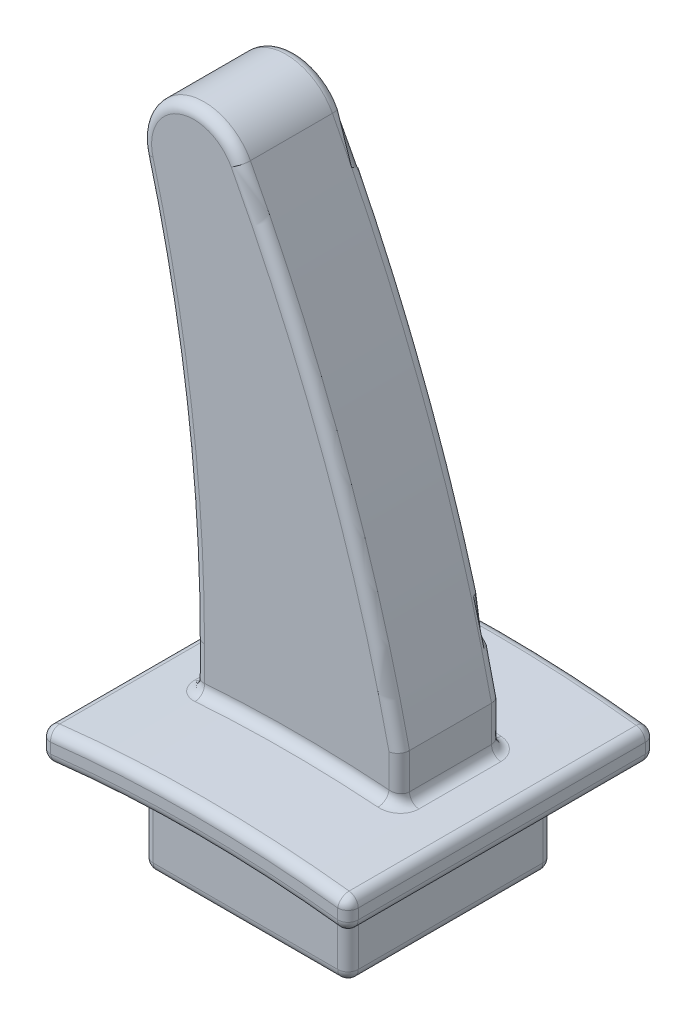
from build123d import *

# Parameters (mm, degrees)
EXTRUDE_1_DEPTH      = 15
EXTRUDE_1_DEPTH_BACK = 15
SKETCH_2_W           = 20
SKETCH_2_H           = 20
EXTRUDE_2_DEPTH      = 12
EXTRUDE_3_DEPTH      = 5
EXTRUDE_3_DEPTH_BACK = 5
FILLET_2_R           = 1
FILLET_4_R           = 1
SKETCH_5_W           = 16
SKETCH_5_H           = 16
CUT_EXTRUDE_1_DEPTH  = 8
FILLET_5_R           = 1


with BuildPart() as part:
    # 草图1 → 凸台-拉伸1 (new, two sides: drawn at the far end of the back side and taken through both)
    with BuildSketch(Plane.XY.offset(-EXTRUDE_1_DEPTH_BACK)):
        with BuildLine():
            Line((15, 119.058808998), (15, 122.081939696))
            ThreePointArc((15, 122.081939696), (0, 123), (-15, 122.081939696))
            Line((-15, 122.081939696), (-15, 119.058808998))
            ThreePointArc((-15, 119.058808998), (0, 120), (15, 119.058808998))
        make_face()
    extrude(amount=EXTRUDE_1_DEPTH + EXTRUDE_1_DEPTH_BACK)

    # 草图2 → 凸台-拉伸2 (add)
    with BuildSketch(Plane(origin=(0, 110, 0), x_dir=(1, 0, 0), z_dir=(0, 1, 0))):
        Rectangle(SKETCH_2_W, SKETCH_2_H)
    extrude(amount=EXTRUDE_2_DEPTH)

    # 草图3 → 凸台-拉伸3 (add, two sides: drawn at the far end of the back side and taken through both)
    with BuildSketch(Plane.XY.offset(-EXTRUDE_3_DEPTH_BACK)):
        with BuildLine():
            Line((-10, 122), (10, 122))
            Line((10, 122), (10, 127))
            ThreePointArc((10, 127), (3.661365521, 148.561524403), (-5.517283492, 169.075666451))
            ThreePointArc((-5.517283492, 169.075666451), (-11.907047436, 171.441878398), (-14.989223115, 165.365017751))
            ThreePointArc((-14.989223115, 165.365017751), (-11.252535261, 146.344036125), (-10, 127))
            Line((-10, 127), (-10, 122))
        make_face()
    extrude(amount=EXTRUDE_3_DEPTH + EXTRUDE_3_DEPTH_BACK)

    # 圆角2
    fillet_2_edges = [part.edges().sort_by_distance(p)[0] for p in [
        (0, 120, 15),
        (0, 123, -15),
        (15, 120.570374347, 15),
        (0, 123, 15),
        (-15, 120.570374347, 15),
        (-15, 120.570374347, -15),
        (0, 120, -10),
        (10, 119.582607431, 0),
        (0, 120, 10),
        (-10, 119.582607431, 0),
        (-10, 114.791303716, 10),
        (0, 110, 10),
        (10, 114.791303716, -10),
        (0, 110, -10),
        (-10, 114.791303716, -10),
        (-10, 110, 0),
        (10, 114.791303716, 10),
        (10, 110, 0),
        (0, 120, -15),
        (-15, 119.058808998, 0),
        (-15, 122.081939696, 0),
        (15, 122.081939696, 0),
        (15, 119.058808998, 0),
        (15, 120.570374347, -15),
    ]]
    fillet(fillet_2_edges, radius=FILLET_2_R)

    # 圆角4
    fillet_4_edges = [part.edges().sort_by_distance(p)[0] for p in [
        (0, 123, 5),
        (10, 122.592821976, 0),
        (-10, 122.592821976, 0),
        (0, 123, -5),
        (-10, 124.796410988, -5),
        (-11.252535261, 146.344036125, -5),
        (-11.907047436, 171.441878398, -5),
        (3.661365521, 148.561524403, -5),
        (10, 124.796410988, -5),
        (-10, 124.796410988, 5),
        (10, 124.796410988, 5),
        (3.661365521, 148.561524403, 5),
        (-11.907047436, 171.441878398, 5),
        (-11.252535261, 146.344036125, 5),
    ]]
    fillet(fillet_4_edges, radius=FILLET_4_R)

    # 草图5 → 切除-拉伸1 (cut)
    with BuildSketch(Plane.XZ.offset(-110)):
        Rectangle(SKETCH_5_W, SKETCH_5_H)
    extrude(amount=-CUT_EXTRUDE_1_DEPTH, mode=Mode.SUBTRACT)

    # 圆角5
    fillet_5_edges = [part.edges().sort_by_distance(p)[0] for p in [
        (-8, 118, 0),
        (-8, 114, -8),
        (0, 118, 8),
        (-8, 114, 8),
        (8, 118, 0),
        (8, 114, 8),
        (0, 118, -8),
        (8, 114, -8),
        (-8, 110, 0),
        (0, 110, -8),
        (8, 110, 0),
        (0, 110, 8),
    ]]
    fillet(fillet_5_edges, radius=FILLET_5_R - 0.0001)  # a hair under: the kernel refuses the full size


solid = part.part
